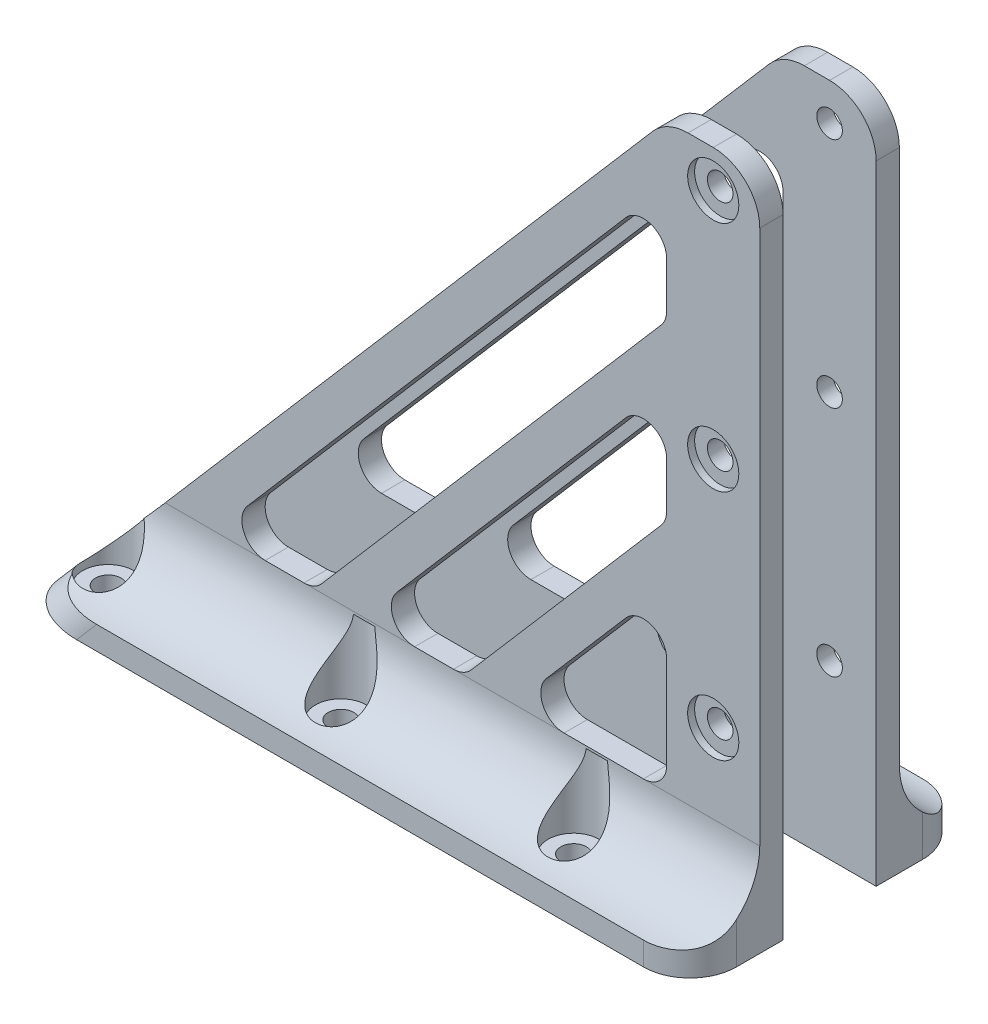
from build123d import *

# Parameters (mm, degrees)
BOSS_EXTRUDE1_DEPTH = 5
SKETCH4_W           = 145
SKETCH4_H           = 15
BOSS_EXTRUDE2_DEPTH = 5
CUT_EXTRUDE1_DEPTH  = 25
SKETCH6_R           = 2.7499999999999996
SKETCH6_R_2         = 2.7500000000000004
CUT_EXTRUDE2_DEPTH  = 25
SKETCH7_R           = 2.750000000000008
CUT_EXTRUDE3_DEPTH  = 25
FILLET1_R           = 15
FILLET2_R           = 10
CUT_EXTRUDE4_START  = -3.5
SKETCH8_R           = 5.500000000000016
SKETCH8_R_2         = 5.5000000000000036
SKETCH8_R_3         = 5.4999999999999964
CUT_EXTRUDE4_DEPTH  = 16
SKETCH9_R           = 5.499999999999999
SKETCH9_R_2         = 5.500000000000001
CUT_EXTRUDE5_DEPTH  = 1.5
CUT_EXTRUDE6_DEPTH  = 8
FILLET3_R           = 5


with BuildPart() as part:
    # Sketch1 → Boss-Extrude1 (new body)
    with BuildSketch(Plane.XY):
        Polygon((0, 0), (-145, 0), (-20, 145), (-1.1e-15, 145), align=None)
    extrude(amount=BOSS_EXTRUDE1_DEPTH)

    # Sketch4 → Boss-Extrude2 (add)
    with BuildSketch(Plane.XZ):
        with Locations((-72.5, 12.5)):
            Rectangle(SKETCH4_W, SKETCH4_H)
    extrude(amount=-BOSS_EXTRUDE2_DEPTH)

    # Sketch5 → Cut-Extrude1 (cut)
    with BuildSketch(Plane(origin=(0, 0, 5), x_dir=(-1, 0, 0), z_dir=(0, 0, -1))):
        Polygon((145, 5), (145, 0), (140.68965517241378, 5), align=None)
    extrude(amount=-CUT_EXTRUDE1_DEPTH, mode=Mode.SUBTRACT)

    # Sketch6 → Cut-Extrude2 (cut)
    with BuildSketch(Plane.XY.offset(5)):
        with Locations((-10, 136.99999999999997)):
            Circle(SKETCH6_R)
        with Locations((-9.99999999999948, 86.99999999999999)):
            Circle(SKETCH6_R)
        with Locations((-9.999999999998959, 36.99999999999998)):
            Circle(SKETCH6_R_2)
    extrude(amount=-CUT_EXTRUDE2_DEPTH, mode=Mode.SUBTRACT)

    # Sketch7 → Cut-Extrude3 (cut)
    with BuildSketch(Plane.XZ):
        with Locations(Location((-134.99999999999997, 10, 0), (0, 0, 270))):
            Circle(SKETCH7_R)
        with Locations(Location((-84.99999999999997, 10, 0), (0, 0, 270))):
            Circle(SKETCH7_R)
        with Locations(Location((-34.99999999999998, 10, 0), (0, 0, 270))):
            Circle(SKETCH7_R)
    extrude(amount=-CUT_EXTRUDE3_DEPTH, mode=Mode.SUBTRACT)

    # Fillet1
    # the kernel refuses this fillet: 15 mm, written as the material it adds along each edge
    with BuildSketch(Plane(origin=(-178.18965517241378, 5, 5), x_dir=(0, 1, 0), z_dir=(1, 0, 0))) as fillet1_piece_1_section:
        with BuildLine():
            CenterArc((FILLET1_R, FILLET1_R), FILLET1_R, 180, 90)
            Line((0, FILLET1_R), (0, 0))
            Line((0, 0), (FILLET1_R, 0))
        make_face()
    fillet1_piece_1 = extrude(amount=178.18965517241378, mode=Mode.PRIVATE)
    fillet1_piece_1 = split(fillet1_piece_1, bisect_by=Plane(origin=(-108.14633732404288, 42.75024870411013, 8.388088500209152), z_dir=(0.7574099616005759, -0.652939622069464, 0)), keep=Keep.TOP, mode=Mode.PRIVATE)
    fillet1_piece_1 = fillet1_piece_1 - Plane(origin=(-34.99999999999998, 8.383128341575194, 10), x_dir=(-1.8e-16, 0, -1), z_dir=(0, -1, 0)) * Cylinder(2.750000000000008, 417, mode=Mode.PRIVATE)
    fillet1_piece_1 = fillet1_piece_1 - Plane(origin=(-84.99999999999997, 8.383128341575194, 10), x_dir=(-1.8e-16, 0, -1), z_dir=(0, -1, 0)) * Cylinder(2.750000000000008, 417, mode=Mode.PRIVATE)
    fillet1_piece_1 = fillet1_piece_1 - Plane(origin=(-134.99999999999997, 8.383128341575194, 10), x_dir=(-1.8e-16, 0, -1), z_dir=(0, -1, 0)) * Cylinder(2.750000000000008, 417, mode=Mode.PRIVATE)
    add(fillet1_piece_1)

    # Fillet2
    fillet2_edges = [part.edges().sort_by_distance(p)[0] for p in [
        (-1.1e-15, 145, 2.5),
        (-20, 145, 2.5),
        (0, 2.5, 20),
        (-142.8448275862069, 2.500000000000007, 20),
    ]]
    fillet(fillet2_edges, radius=FILLET2_R)

    # Sketch8 → Cut-Extrude4 (cut)
    with BuildSketch(Plane.XZ.offset(CUT_EXTRUDE4_START)):
        with Locations(Location((-134.99999999999997, 10, 0), (0, 0, 270))):
            Circle(SKETCH8_R)
        with Locations(Location((-84.99999999999997, 10, 0), (0, 0, 270))):
            Circle(SKETCH8_R_2)
        with Locations(Location((-34.99999999999998, 10, 0), (0, 0, 270))):
            Circle(SKETCH8_R_3)
    extrude(amount=-CUT_EXTRUDE4_DEPTH, mode=Mode.SUBTRACT)

    # Sketch9 → Cut-Extrude5 (cut)
    with BuildSketch(Plane.XY.offset(5)):
        with Locations((-9.999999999998959, 36.99999999999998)):
            Circle(SKETCH9_R)
        with Locations((-9.99999999999948, 86.99999999999999)):
            Circle(SKETCH9_R_2)
        with Locations((-10, 136.99999999999997)):
            Circle(SKETCH9_R_2)
    extrude(amount=-CUT_EXTRUDE5_DEPTH, mode=Mode.SUBTRACT)

    # Sketch10 → Cut-Extrude6 (cut)
    with BuildSketch(Plane.XY.offset(5)):
        Polygon((-117.19630912050938, 20.000000000000007), (-20.000000000000004, 132.74771857979096), (-19.999999999999996, 107.74771857979096), (-95.6445849825784, 20.000000000000007), align=None)
        Polygon((-19.999999999999986, 20.000000000000018), (-52.968237706355886, 20.000000000000014), (-19.99999999999999, 58.24315573937285), align=None)
        Polygon((-85.08227341343266, 20.00000000000001), (-20.000000000000004, 95.49543715958191), (-19.999999999999993, 70.4954371595819), (-63.53054927550161, 20.00000000000001), align=None)
    extrude(amount=-CUT_EXTRUDE6_DEPTH, mode=Mode.SUBTRACT)

    # Fillet3
    fillet3_edges = [part.edges().sort_by_distance(p)[0] for p in [
        (-19.99999999999999, 58.24315573937285, 2.5),
        (-19.999999999999986, 20.000000000000018, 2.5),
        (-52.968237706355886, 20.000000000000014, 2.5),
        (-63.53054927550161, 20.00000000000001, 2.5),
        (-85.08227341343266, 20.00000000000001, 2.5),
        (-20.000000000000004, 95.49543715958191, 2.5),
        (-19.999999999999993, 70.4954371595819, 2.5),
        (-95.6445849825784, 20.000000000000007, 2.5),
        (-117.19630912050938, 20.000000000000007, 2.5),
        (-20.000000000000004, 132.74771857979096, 2.5),
        (-19.999999999999996, 107.74771857979096, 2.5),
    ]]
    fillet(fillet3_edges, radius=FILLET3_R)


with BuildPart() as body_2:
    # Mirror2: mirrored copy
    add(part.part.mirror(Plane(origin=(0, 0, -10), x_dir=(1, 0, 0), z_dir=(0, 0, -1))))


solid = Compound([part.part, body_2.part])
